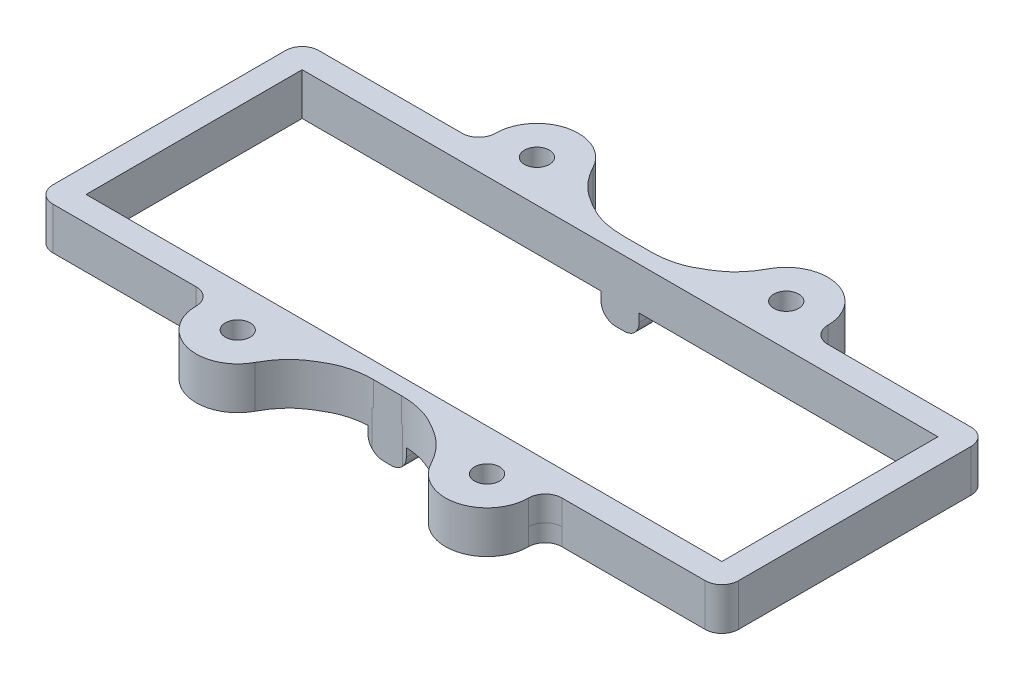
from build123d import *
from build123d.topology import SkipClean

# Parameters (mm, degrees)
SKETCH1_W           = 40
SKETCH1_H           = 7
SKETCH1_R           = 1.5
SKETCH1_W_2         = 82.5
SKETCH1_H_2         = 32
SKETCH1_W_3         = 76.5
SKETCH1_H_3         = 26
BOSS_EXTRUDE1_DEPTH = 2.085
SKETCH2_W           = 5
SKETCH2_H           = 10
BOSS_EXTRUDE2_DEPTH = 3
FILLET1_R           = 2
FILLET2_R           = 2
CUT_EXTRUDE1_DEPTH  = 65.136818612
SKETCH4_W           = 30
SKETCH4_H           = 6.817038716
CUT_EXTRUDE2_DEPTH  = 53.089568977
FILLET3_R           = 5
FILLET4_R           = 2
BOSS_EXTRUDE3_START = 3
SKETCH5_R           = 1.5
BOSS_EXTRUDE3_DEPTH = 3
FILLET5_START       = 2.085
FILLET5_DEPTH       = 3


with BuildPart() as part:
    # Sketch1 → Boss-Extrude1 (new body)
    # profile 1 of 3: a face of its own
    with BuildSketch(Plane(origin=(0, 0, 0), x_dir=(1, 0, 0), z_dir=(0, 1, 0))):
        with Locations((-3.342953498, -16.024946279)):
            Rectangle(SKETCH1_W, SKETCH1_H)
        with Locations(Location((-18.342953498, -14.524946279, 0), (0, 0, 270))):
            Circle(SKETCH1_R, mode=Mode.SUBTRACT)
        with Locations(Location((11.657046502, -14.524946279, 0), (0, 0, 270))):
            Circle(SKETCH1_R, mode=Mode.SUBTRACT)
    # profile 2 of 3: a face of its own
    with BuildSketch(Plane(origin=(0, 0, 0), x_dir=(1, 0, 0), z_dir=(0, 1, 0))):
        with Locations((-3.342953498, 3.475053721)):
            Rectangle(SKETCH1_W_2, SKETCH1_H_2)
        with Locations((-3.342953498, 3.475053721)):
            Rectangle(SKETCH1_W_3, SKETCH1_H_3, mode=Mode.SUBTRACT)
    # profile 3 of 3: a face of its own
    with BuildSketch(Plane(origin=(0, 0, 0), x_dir=(1, 0, 0), z_dir=(0, 1, 0))):
        with Locations((-3.342953498, 22.975053721)):
            Rectangle(SKETCH1_W, SKETCH1_H)
        with Locations(Location((-18.342953498, 21.475053721, 0), (0, 0, 270))):
            Circle(SKETCH1_R, mode=Mode.SUBTRACT)
        with Locations(Location((11.657046502, 21.475053721, 0), (0, 0, 270))):
            Circle(SKETCH1_R, mode=Mode.SUBTRACT)
    extrude(amount=BOSS_EXTRUDE1_DEPTH)

    # Sketch2 → Boss-Extrude2 (add)
    with BuildSketch(Plane.XZ):
        with Locations((-3.342953498, 14.524946279)):
            Rectangle(SKETCH2_W, SKETCH2_H)
        with Locations((-3.342953498, -21.475053721)):
            Rectangle(SKETCH2_W, SKETCH2_H)
    extrude(amount=BOSS_EXTRUDE2_DEPTH)

    # Fillet1
    fillet1_edges = [part.edges().sort_by_distance(p)[0] for p in [
        (-5.842953498, -3, 14.524946279),
        (-0.842953498, -3, 14.524946279),
        (-0.842953498, -3, -21.475053721),
        (-5.842953498, -3, -21.475053721),
    ]]
    fillet(fillet1_edges, radius=FILLET1_R)

    # Fillet2
    fillet2_edges = [part.edges().sort_by_distance(p)[0] for p in [
        (-44.592953498, 1.0425, 12.524946279),
        (-44.592953498, 1.0425, -19.475053721),
        (37.907046502, 1.0425, -19.475053721),
        (37.907046502, 1.0425, 12.524946279),
    ]]
    fillet(fillet2_edges, radius=FILLET2_R)

    # Sketch3 → Cut-Extrude1 (cut, through all)
    with BuildSketch(Plane(origin=(0, 0, -26.475053721), x_dir=(-1, 0, 0), z_dir=(0, 0, -1))):
        with BuildLine():
            Line((5.842953498, -1), (5.842953498, 0))
            Line((5.842953498, 0), (5.642953498, 0))
            Line((5.642953498, 0), (5.642953498, -1))
            ThreePointArc((5.642953498, -1), (5.115745704, -2.272792206), (3.842953498, -2.8))
            Line((3.842953498, -2.8), (2.842953498, -2.8))
            ThreePointArc((2.842953498, -2.8), (1.570161291, -2.272792206), (1.042953498, -1))
            Line((1.042953498, -1), (1.042953498, 0))
            Line((1.042953498, 0), (0.842953498, 0))
            Line((0.842953498, 0), (0.842953498, -1))
            ThreePointArc((0.842953498, -1), (1.428739935, -2.414213562), (2.842953498, -3))
            Line((2.842953498, -3), (3.842953498, -3))
            ThreePointArc((3.842953498, -3), (5.25716706, -2.414213562), (5.842953498, -1))
        make_face()
    extrude(amount=-CUT_EXTRUDE1_DEPTH, mode=Mode.SUBTRACT)

    # Sketch4 → Cut-Extrude2 (cut, through all)
    with BuildSketch(Plane(origin=(0, 2.085, 0), x_dir=(1, 0, 0), z_dir=(0, 1, 0))):
        with BuildLine():
            Line((-5.025587433, 18.475053721), (-3.342953498, 18.475053721))
            Line((-3.342953498, 18.475053721), (-1.660319563, 18.475053721))
            Line((-1.660319563, 18.475053721), (-1.5063675, 18.475053721))
            add(Edge.make_bspline(
                [(7.234880115, 23.808387054), (6.697838422, 22.80689338), (5.54618786, 21.222701251), (3.456402004, 19.887657692), (1.890908212, 19.048171258), (0.265447838, 18.611656881), (-0.841891354, 18.480685845), (-1.5063675, 18.475053721)],
                knots=[0, 0, 0, 0, 0.31493804, 0.524439854, 0.679221784, 0.802825172, 0.985869019, 0.985869019, 0.985869019, 0.985869019], degree=3))
            ThreePointArc((7.234880115, 23.808387054), (9.075057605, 25.756797914), (11.657046502, 26.475053721))
            Line((11.657046502, 26.475053721), (-18.342953498, 26.475053721))
            ThreePointArc((-18.342953498, 26.475053721), (-15.7609646, 25.756797914), (-13.92078711, 23.808387054))
            add(Edge.make_bspline(
                [(-13.92078711, 23.808387054), (-13.383745417, 22.80689338), (-12.232094855, 21.222701251), (-10.142308999, 19.887657692), (-8.576815207, 19.048171258), (-6.951354833, 18.611656881), (-5.844015641, 18.480685845), (-5.179539495, 18.475053721)],
                knots=[0, 0, 0, 0, 0.31493804, 0.524439854, 0.679221784, 0.802825172, 0.985869019, 0.985869019, 0.985869019, 0.985869019], degree=3))
            Line((-5.179539495, 18.475053721), (-5.025587433, 18.475053721))
        make_face()
        with Locations((-3.342953498, 29.883573079)):
            Rectangle(SKETCH4_W, SKETCH4_H)
        with BuildLine():
            ThreePointArc((-13.92078711, -16.858279612), (-15.7609646, -18.806690472), (-18.342953498, -19.524946279))
            Line((-18.342953498, -19.524946279), (11.657046502, -19.524946279))
            ThreePointArc((11.657046502, -19.524946279), (9.075057605, -18.806690472), (7.234880115, -16.858279612))
            add(Edge.make_bspline(
                [(7.234880115, -16.858279612), (6.697838422, -15.856785937), (5.54618786, -14.272593809), (3.456402004, -12.937550249), (1.890908212, -12.098063816), (0.265447838, -11.661549439), (-0.841891354, -11.530578403), (-1.5063675, -11.524946279)],
                knots=[0, 0, 0, 0, 0.31493804, 0.524439854, 0.679221784, 0.802825172, 0.985869019, 0.985869019, 0.985869019, 0.985869019], degree=3))
            Line((-1.5063675, -11.524946279), (-1.660319563, -11.524946279))
            Line((-1.660319563, -11.524946279), (-3.342953498, -11.524946279))
            Line((-3.342953498, -11.524946279), (-5.025587433, -11.524946279))
            Line((-5.025587433, -11.524946279), (-5.179539495, -11.524946279))
            add(Edge.make_bspline(
                [(-13.92078711, -16.858279612), (-13.383745417, -15.856785937), (-12.232094855, -14.272593809), (-10.142308999, -12.937550249), (-8.576815207, -12.098063816), (-6.951354833, -11.661549439), (-5.844015641, -11.530578403), (-5.179539495, -11.524946279)],
                knots=[0, 0, 0, 0, 0.31493804, 0.524439854, 0.679221784, 0.802825172, 0.985869019, 0.985869019, 0.985869019, 0.985869019], degree=3))
        make_face()
        with Locations((-3.342953498, -22.933465637)):
            Rectangle(SKETCH4_W, SKETCH4_H)
    extrude(amount=-CUT_EXTRUDE2_DEPTH, mode=Mode.SUBTRACT)

    # Fillet3
    fillet3_edges = [part.edges().sort_by_distance(p)[0] for p in [
        (16.657046502, 1.0425, -26.475053721),
        (-23.342953498, 1.0425, -26.475053721),
        (-23.342953498, 1.0425, 19.524946279),
        (16.657046502, 1.0425, 19.524946279),
    ]]
    fillet(fillet3_edges, radius=FILLET3_R - 0.0001)  # a hair under: the kernel refuses the full size

    # Fillet4
    fillet4_edges = [part.edges().sort_by_distance(p)[0] for p in [
        (-23.342953498, 1.0425, 12.524946279),
        (-23.342953498, 1.0425, -19.475053721),
        (16.657046502, 1.0425, -19.475053721),
        (16.657046502, 1.0425, 12.524946279),
    ]]
    fillet(fillet4_edges, radius=FILLET4_R)

    # Sketch5 → Boss-Extrude3 (add)
    # profile 1 of 26: a face of its own
    with SkipClean():  # the faces are left unmerged after this step: merging them gives an invalid solid
        with BuildSketch(Plane(origin=(0, 2.085, 0), x_dir=(1, 0, 0), z_dir=(0, 1, 0)).offset(BOSS_EXTRUDE3_START)):
            with BuildLine():
                ThreePointArc((-18.343003498, 26.475053721), (-21.878490939, 25.010584091), (-23.342953497, 21.475093721))
                ThreePointArc((-23.342953497, 21.475093721), (-23.237489148, 20.453525081), (-22.925529193, 19.475053721))
                Line((-22.925529193, 19.475053721), (-14.342953498, 19.475053721))
                Line((-14.342953498, 19.475053721), (-14.342953498, 24.475053721))
                ThreePointArc((-14.342953498, 24.475053721), (-16.106907881, 25.947200856), (-18.343003498, 26.475053721))
            make_face()
            with Locations((-18.342953498, 21.475053721)):
                Circle(SKETCH5_R, mode=Mode.SUBTRACT)
        # profile 2 of 26: a face of its own
        with BuildSketch(Plane(origin=(0, 2.085, 0), x_dir=(1, 0, 0), z_dir=(0, 1, 0)).offset(BOSS_EXTRUDE3_START)):
            with BuildLine():
                Line((-22.925529193, 19.475053721), (-23.342953498, 19.475053721))
                Line((-23.342953498, 19.475053721), (-23.342953498, 16.475053721))
                Line((-23.342953498, 16.475053721), (-18.342953499, 16.475053721))
                ThreePointArc((-18.342953499, 16.475053721), (-21.081566286, 17.291753589), (-22.925529193, 19.475053721))
            make_face()
        # profile 3 of 26: a face of its own
        with BuildSketch(Plane(origin=(0, 2.085, 0), x_dir=(1, 0, 0), z_dir=(0, 1, 0)).offset(BOSS_EXTRUDE3_START)):
            with BuildLine():
                Line((-23.342953498, 16.475053721), (-23.342953498, 19.475053721))
                Line((-23.342953498, 19.475053721), (-25.342953498, 19.475053721))
                Line((-25.342953498, 19.475053721), (-42.592953498, 19.475053721))
                ThreePointArc((-42.592953498, 19.475053721), (-44.00716706, 18.889267283), (-44.592953498, 17.475053721))
                Line((-44.592953498, 17.475053721), (-44.592953498, -10.524946279))
                ThreePointArc((-44.592953498, -10.524946279), (-44.00716706, -11.939159841), (-42.592953498, -12.524946279))
                Line((-42.592953498, -12.524946279), (-25.342953498, -12.524946279))
                Line((-25.342953498, -12.524946279), (-23.342953498, -12.524946279))
                Line((-23.342953498, -12.524946279), (-23.342953498, -9.524946279))
                Line((-23.342953498, -9.524946279), (-41.592953498, -9.524946279))
                Line((-41.592953498, -9.524946279), (-41.592953498, 16.475053721))
                Line((-41.592953498, 16.475053721), (-23.342953498, 16.475053721))
            make_face()
        # profile 4 of 26: a face of its own
        with BuildSketch(Plane(origin=(0, 2.085, 0), x_dir=(1, 0, 0), z_dir=(0, 1, 0)).offset(BOSS_EXTRUDE3_START)):
            with BuildLine():
                Line((-14.342953498, 19.475053721), (-22.925529193, 19.475053721))
                ThreePointArc((-22.925529193, 19.475053721), (-21.081566286, 17.291753589), (-18.342953499, 16.475053721))
                ThreePointArc((-18.342953499, 16.475053721), (-16.106885521, 17.002917766), (-14.342953498, 18.475053721))
                Line((-14.342953498, 18.475053721), (-14.342953498, 19.475053721))
            make_face()
        # profile 5 of 26: a face of its own
        with BuildSketch(Plane(origin=(0, 2.085, 0), x_dir=(1, 0, 0), z_dir=(0, 1, 0)).offset(BOSS_EXTRUDE3_START)):
            with BuildLine():
                ThreePointArc((-13.92078711, 23.808387054), (-14.118698205, 24.150061614), (-14.342953498, 24.475053721))
                Line((-14.342953498, 24.475053721), (-14.342953498, 19.475053721))
                Line((-14.342953498, 19.475053721), (-13.760377803, 19.475053721))
                ThreePointArc((-13.760377803, 19.475053721), (-13.448421933, 20.453505503), (-13.342953498, 21.475053721))
                ThreePointArc((-13.342953498, 21.475053721), (-13.489561285, 22.676962217), (-13.92078711, 23.808387054))
            make_face()
        # profile 6 of 26: a face of its own
        with BuildSketch(Plane(origin=(0, 2.085, 0), x_dir=(1, 0, 0), z_dir=(0, 1, 0)).offset(BOSS_EXTRUDE3_START)):
            with BuildLine():
                Line((-13.760377803, 19.475053721), (-14.342953498, 19.475053721))
                Line((-14.342953498, 19.475053721), (-14.342953498, 18.475053721))
                ThreePointArc((-14.342953498, 18.475053721), (-14.022635061, 18.958141206), (-13.760377803, 19.475053721))
            make_face()
        # profile 7 of 26: a face of its own
        with BuildSketch(Plane(origin=(0, 2.085, 0), x_dir=(1, 0, 0), z_dir=(0, 1, 0)).offset(BOSS_EXTRUDE3_START)):
            with BuildLine():
                ThreePointArc((-14.342953498, 18.475053721), (-16.106885521, 17.002917766), (-18.342953499, 16.475053721))
                Line((-18.342953499, 16.475053721), (11.657046523, 16.475053721))
                ThreePointArc((11.657046523, 16.475053721), (9.420978534, 17.002917762), (7.657046502, 18.475053721))
                Line((7.657046502, 18.475053721), (-1.5063675, 18.475053721))
                add(Edge.make_bspline(
                    [(-1.5063675, 18.475053721), (-1.557665042, 18.474618921), (-1.608983344, 18.47461649), (-1.660319563, 18.475053721)],
                    knots=[0.985869019, 0.985869019, 0.985869019, 0.985869019, 1, 1, 1, 1], degree=3))
                Line((-1.660319563, 18.475053721), (-3.342953498, 18.475053721))
                Line((-3.342953498, 18.475053721), (-5.025587433, 18.475053721))
                add(Edge.make_bspline(
                    [(-5.179539495, 18.475053721), (-5.128241953, 18.474618921), (-5.076923651, 18.47461649), (-5.025587433, 18.475053721)],
                    knots=[0.985869019, 0.985869019, 0.985869019, 0.985869019, 1, 1, 1, 1], degree=3))
                Line((-5.179539495, 18.475053721), (-14.342953498, 18.475053721))
            make_face()
        # profile 8 of 26: a face of its own
        with BuildSketch(Plane(origin=(0, 2.085, 0), x_dir=(1, 0, 0), z_dir=(0, 1, 0)).offset(BOSS_EXTRUDE3_START)):
            with BuildLine():
                add(Edge.make_bspline(
                    [(-13.92078711, 23.808387054), (-13.383745417, 22.80689338), (-12.232094855, 21.222701251), (-10.424029044, 20.067632367), (-9.557996846, 19.581589064), (-9.354549961, 19.475053721)],
                    knots=[0, 0, 0, 0, 0.31493804, 0.524439854, 0.587657191, 0.587657191, 0.587657191, 0.587657191], degree=3))
                ThreePointArc((-13.92078711, 23.808387054), (-13.489561285, 22.676962217), (-13.342953498, 21.475053721))
                ThreePointArc((-13.342953498, 21.475053721), (-13.448421933, 20.453505503), (-13.760377803, 19.475053721))
                Line((-13.760377803, 19.475053721), (-9.354549961, 19.475053721))
            make_face()
        # profile 9 of 26: a face of its own
        with BuildSketch(Plane(origin=(0, 2.085, 0), x_dir=(1, 0, 0), z_dir=(0, 1, 0)).offset(BOSS_EXTRUDE3_START)):
            with BuildLine():
                ThreePointArc((-13.760377803, 19.475053721), (-14.022635061, 18.958141206), (-14.342953498, 18.475053721))
                Line((-14.342953498, 18.475053721), (-5.179539495, 18.475053721))
                add(Edge.make_bspline(
                    [(-9.354549961, 19.475053721), (-9.059875559, 19.320746917), (-8.354121704, 18.98836733), (-6.951354833, 18.611656881), (-5.844015641, 18.480685845), (-5.179539495, 18.475053721)],
                    knots=[0.587657191, 0.587657191, 0.587657191, 0.587657191, 0.679221784, 0.802825172, 0.985869019, 0.985869019, 0.985869019, 0.985869019], degree=3))
                Line((-9.354549961, 19.475053721), (-13.760377803, 19.475053721))
            make_face()
        # profile 10 of 26: a face of its own
        with BuildSketch(Plane(origin=(0, 2.085, 0), x_dir=(1, 0, 0), z_dir=(0, 1, 0)).offset(BOSS_EXTRUDE3_START)):
            with BuildLine():
                ThreePointArc((16.239622197, 19.475053721), (14.395659298, 17.291753594), (11.657046523, 16.475053721))
                Line((11.657046523, 16.475053721), (16.657046502, 16.475053721))
                Line((16.657046502, 16.475053721), (16.657046502, 19.475053721))
                Line((16.657046502, 19.475053721), (16.239622197, 19.475053721))
            make_face()
        # profile 11 of 26: a face of its own
        with BuildSketch(Plane(origin=(0, 2.085, 0), x_dir=(1, 0, 0), z_dir=(0, 1, 0)).offset(BOSS_EXTRUDE3_START)):
            with BuildLine():
                ThreePointArc((7.657046502, 18.475053721), (9.420978534, 17.002917762), (11.657046523, 16.475053721))
                ThreePointArc((11.657046523, 16.475053721), (14.395659298, 17.291753594), (16.239622197, 19.475053721))
                Line((16.239622197, 19.475053721), (7.074470807, 19.475053721))
                ThreePointArc((7.074470807, 19.475053721), (7.336728066, 18.958141206), (7.657046502, 18.475053721))
            make_face()
        # profile 12 of 26: a face of its own
        with BuildSketch(Plane(origin=(0, 2.085, 0), x_dir=(1, 0, 0), z_dir=(0, 1, 0)).offset(BOSS_EXTRUDE3_START)):
            with BuildLine():
                Line((16.657046502, 19.475053721), (16.657046502, 16.475053721))
                Line((16.657046502, 16.475053721), (34.907046502, 16.475053721))
                Line((34.907046502, 16.475053721), (34.907046502, -9.524946279))
                Line((34.907046502, -9.524946279), (16.657046502, -9.524946279))
                Line((16.657046502, -9.524946279), (16.657046502, -12.524946279))
                Line((16.657046502, -12.524946279), (18.657046502, -12.524946279))
                Line((18.657046502, -12.524946279), (35.907046502, -12.524946279))
                ThreePointArc((35.907046502, -12.524946279), (37.321260065, -11.939159841), (37.907046502, -10.524946279))
                Line((37.907046502, -10.524946279), (37.907046502, 17.475053721))
                ThreePointArc((37.907046502, 17.475053721), (37.321260065, 18.889267283), (35.907046502, 19.475053721))
                Line((35.907046502, 19.475053721), (18.657046502, 19.475053721))
                Line((18.657046502, 19.475053721), (16.657046502, 19.475053721))
            make_face()
        # profile 13 of 26: a face of its own
        with BuildSketch(Plane(origin=(0, 2.085, 0), x_dir=(1, 0, 0), z_dir=(0, 1, 0)).offset(BOSS_EXTRUDE3_START)):
            with BuildLine():
                Line((-1.5063675, 18.475053721), (7.657046502, 18.475053721))
                ThreePointArc((7.657046502, 18.475053721), (7.336728066, 18.958141206), (7.074470807, 19.475053721))
                Line((7.074470807, 19.475053721), (2.668642966, 19.475053721))
                add(Edge.make_bspline(
                    [(2.668642966, 19.475053721), (2.373968563, 19.320746917), (1.668214709, 18.98836733), (0.265447838, 18.611656881), (-0.841891354, 18.480685845), (-1.5063675, 18.475053721)],
                    knots=[0.587657191, 0.587657191, 0.587657191, 0.587657191, 0.679221784, 0.802825172, 0.985869019, 0.985869019, 0.985869019, 0.985869019], degree=3))
            make_face()
        # profile 14 of 26: a face of its own
        with BuildSketch(Plane(origin=(0, 2.085, 0), x_dir=(1, 0, 0), z_dir=(0, 1, 0)).offset(BOSS_EXTRUDE3_START)):
            with BuildLine():
                Line((7.074470807, 19.475053721), (16.239622197, 19.475053721))
                ThreePointArc((16.239622197, 19.475053721), (16.551578067, 20.453505503), (16.657046502, 21.475053721))
                ThreePointArc((16.657046502, 21.475053721), (15.192598086, 25.010569949), (11.657096502, 26.475053721))
                ThreePointArc((11.657096502, 26.475053721), (9.075079014, 25.756810824), (7.234880115, 23.808387054))
                ThreePointArc((7.234880115, 23.808387054), (6.66046873, 21.660014702), (7.074470807, 19.475053721))
            make_face()
            with Locations((11.657046502, 21.475053721)):
                Circle(SKETCH5_R, mode=Mode.SUBTRACT)
        # profile 15 of 26: a face of its own
        with BuildSketch(Plane(origin=(0, 2.085, 0), x_dir=(1, 0, 0), z_dir=(0, 1, 0)).offset(BOSS_EXTRUDE3_START)):
            with BuildLine():
                Line((-18.342953493, -9.524946279), (-23.342953498, -9.524946279))
                Line((-23.342953498, -9.524946279), (-23.342953498, -12.524946279))
                Line((-23.342953498, -12.524946279), (-22.925529193, -12.524946279))
                ThreePointArc((-22.925529193, -12.524946279), (-21.081566283, -10.341646145), (-18.342953493, -9.524946279))
            make_face()
        # profile 16 of 26: a face of its own
        with BuildSketch(Plane(origin=(0, 2.085, 0), x_dir=(1, 0, 0), z_dir=(0, 1, 0)).offset(BOSS_EXTRUDE3_START)):
            with BuildLine():
                add(Edge.make_bspline(
                    [(7.234880115, 23.808387054), (6.697838422, 22.80689338), (5.54618786, 21.222701251), (3.738122049, 20.067632367), (2.872089851, 19.581589064), (2.668642966, 19.475053721)],
                    knots=[0, 0, 0, 0, 0.31493804, 0.524439854, 0.587657191, 0.587657191, 0.587657191, 0.587657191], degree=3))
                Line((2.668642966, 19.475053721), (7.074470807, 19.475053721))
                ThreePointArc((7.074470807, 19.475053721), (6.66046873, 21.660014702), (7.234880115, 23.808387054))
            make_face()
        # profile 17 of 26: a face of its own
        with BuildSketch(Plane(origin=(0, 2.085, 0), x_dir=(1, 0, 0), z_dir=(0, 1, 0)).offset(BOSS_EXTRUDE3_START)):
            with BuildLine():
                Line((11.657046502, -9.524946279), (-18.342953493, -9.524946279))
                ThreePointArc((-18.342953493, -9.524946279), (-16.106885518, -10.052810325), (-14.342953498, -11.524946279))
                Line((-14.342953498, -11.524946279), (-5.179539495, -11.524946279))
                add(Edge.make_bspline(
                    [(-5.179539495, -11.524946279), (-5.128241953, -11.524511479), (-5.076923651, -11.524509048), (-5.025587433, -11.524946279)],
                    knots=[0.985869019, 0.985869019, 0.985869019, 0.985869019, 1, 1, 1, 1], degree=3))
                Line((-5.025587433, -11.524946279), (-3.342953498, -11.524946279))
                Line((-3.342953498, -11.524946279), (-1.660319563, -11.524946279))
                add(Edge.make_bspline(
                    [(-1.5063675, -11.524946279), (-1.557665042, -11.524511479), (-1.608983344, -11.524509048), (-1.660319563, -11.524946279)],
                    knots=[0.985869019, 0.985869019, 0.985869019, 0.985869019, 1, 1, 1, 1], degree=3))
                Line((-1.5063675, -11.524946279), (7.657046502, -11.524946279))
                ThreePointArc((7.657046502, -11.524946279), (9.420978525, -10.052810324), (11.657046502, -9.524946279))
            make_face()
        # profile 18 of 26: a face of its own
        with BuildSketch(Plane(origin=(0, 2.085, 0), x_dir=(1, 0, 0), z_dir=(0, 1, 0)).offset(BOSS_EXTRUDE3_START)):
            with BuildLine():
                ThreePointArc((-14.342953498, -11.524946279), (-16.106885518, -10.052810325), (-18.342953493, -9.524946279))
                ThreePointArc((-18.342953493, -9.524946279), (-21.081566283, -10.341646145), (-22.925529193, -12.524946279))
                Line((-22.925529193, -12.524946279), (-13.760377803, -12.524946279))
                ThreePointArc((-13.760377803, -12.524946279), (-14.022635061, -12.008033764), (-14.342953498, -11.524946279))
            make_face()
        # profile 19 of 26: a face of its own
        with BuildSketch(Plane(origin=(0, 2.085, 0), x_dir=(1, 0, 0), z_dir=(0, 1, 0)).offset(BOSS_EXTRUDE3_START)):
            with BuildLine():
                Line((16.657046502, -9.524946279), (11.657046502, -9.524946279))
                ThreePointArc((11.657046502, -9.524946279), (14.39565929, -10.341646146), (16.239622197, -12.524946279))
                Line((16.239622197, -12.524946279), (16.657046502, -12.524946279))
                Line((16.657046502, -12.524946279), (16.657046502, -9.524946279))
            make_face()
        # profile 20 of 26: a face of its own
        with BuildSketch(Plane(origin=(0, 2.085, 0), x_dir=(1, 0, 0), z_dir=(0, 1, 0)).offset(BOSS_EXTRUDE3_START)):
            with BuildLine():
                ThreePointArc((16.239622197, -12.524946279), (14.39565929, -10.341646146), (11.657046502, -9.524946279))
                ThreePointArc((11.657046502, -9.524946279), (9.420978525, -10.052810324), (7.657046502, -11.524946279))
                ThreePointArc((7.657046502, -11.524946279), (7.336728066, -12.008033764), (7.074470807, -12.524946279))
                Line((7.074470807, -12.524946279), (16.239622197, -12.524946279))
            make_face()
        # profile 21 of 26: a face of its own
        with BuildSketch(Plane(origin=(0, 2.085, 0), x_dir=(1, 0, 0), z_dir=(0, 1, 0)).offset(BOSS_EXTRUDE3_START)):
            with BuildLine():
                Line((-5.179539495, -11.524946279), (-14.342953498, -11.524946279))
                ThreePointArc((-14.342953498, -11.524946279), (-14.022635061, -12.008033764), (-13.760377803, -12.524946279))
                Line((-13.760377803, -12.524946279), (-9.354549961, -12.524946279))
                add(Edge.make_bspline(
                    [(-9.354549961, -12.524946279), (-9.059875559, -12.370639475), (-8.354121704, -12.038259888), (-6.951354833, -11.661549439), (-5.844015641, -11.530578403), (-5.179539495, -11.524946279)],
                    knots=[0.587657191, 0.587657191, 0.587657191, 0.587657191, 0.679221784, 0.802825172, 0.985869019, 0.985869019, 0.985869019, 0.985869019], degree=3))
            make_face()
        # profile 22 of 26: a face of its own
        with BuildSketch(Plane(origin=(0, 2.085, 0), x_dir=(1, 0, 0), z_dir=(0, 1, 0)).offset(BOSS_EXTRUDE3_START)):
            with BuildLine():
                Line((-13.760377803, -12.524946279), (-22.925529193, -12.524946279))
                ThreePointArc((-22.925529193, -12.524946279), (-23.237489148, -13.503417639), (-23.342953497, -14.524986279))
                ThreePointArc((-23.342953497, -14.524986279), (-21.878490939, -18.060476649), (-18.343003498, -19.524946279))
                ThreePointArc((-18.343003498, -19.524946279), (-15.760986009, -18.806703382), (-13.92078711, -16.858279612))
                ThreePointArc((-13.92078711, -16.858279612), (-13.489561285, -15.726854775), (-13.342953498, -14.524946279))
                ThreePointArc((-13.342953498, -14.524946279), (-13.448421933, -13.50339806), (-13.760377803, -12.524946279))
            make_face()
            with Locations((-18.342953498, -14.524946279)):
                Circle(SKETCH5_R, mode=Mode.SUBTRACT)
        # profile 23 of 26: a face of its own
        with BuildSketch(Plane(origin=(0, 2.085, 0), x_dir=(1, 0, 0), z_dir=(0, 1, 0)).offset(BOSS_EXTRUDE3_START)):
            with BuildLine():
                ThreePointArc((16.657046502, -14.524946279), (16.551578067, -13.50339806), (16.239622197, -12.524946279))
                Line((16.239622197, -12.524946279), (7.074470807, -12.524946279))
                ThreePointArc((7.074470807, -12.524946279), (6.66046873, -14.709907259), (7.234880115, -16.858279612))
                ThreePointArc((7.234880115, -16.858279612), (9.075079014, -18.806703382), (11.657096502, -19.524946279))
                ThreePointArc((11.657096502, -19.524946279), (15.192598086, -18.060462507), (16.657046502, -14.524946279))
            make_face()
            with Locations((11.657046502, -14.524946279)):
                Circle(SKETCH5_R, mode=Mode.SUBTRACT)
        # profile 24 of 26: a face of its own
        with BuildSketch(Plane(origin=(0, 2.085, 0), x_dir=(1, 0, 0), z_dir=(0, 1, 0)).offset(BOSS_EXTRUDE3_START)):
            with BuildLine():
                ThreePointArc((7.074470807, -12.524946279), (7.336728066, -12.008033764), (7.657046502, -11.524946279))
                Line((7.657046502, -11.524946279), (-1.5063675, -11.524946279))
                add(Edge.make_bspline(
                    [(2.668642966, -12.524946279), (2.373968563, -12.370639475), (1.668214709, -12.038259888), (0.265447838, -11.661549439), (-0.841891354, -11.530578403), (-1.5063675, -11.524946279)],
                    knots=[0.587657191, 0.587657191, 0.587657191, 0.587657191, 0.679221784, 0.802825172, 0.985869019, 0.985869019, 0.985869019, 0.985869019], degree=3))
                Line((2.668642966, -12.524946279), (7.074470807, -12.524946279))
            make_face()
        # profile 25 of 26: a face of its own
        with BuildSketch(Plane(origin=(0, 2.085, 0), x_dir=(1, 0, 0), z_dir=(0, 1, 0)).offset(BOSS_EXTRUDE3_START)):
            with BuildLine():
                Line((-9.354549961, -12.524946279), (-13.760377803, -12.524946279))
                ThreePointArc((-13.760377803, -12.524946279), (-13.448421933, -13.50339806), (-13.342953498, -14.524946279))
                ThreePointArc((-13.342953498, -14.524946279), (-13.489561285, -15.726854775), (-13.92078711, -16.858279612))
                add(Edge.make_bspline(
                    [(-13.92078711, -16.858279612), (-13.383745417, -15.856785937), (-12.232094855, -14.272593809), (-10.424029044, -13.117524925), (-9.557996846, -12.631481622), (-9.354549961, -12.524946279)],
                    knots=[0, 0, 0, 0, 0.31493804, 0.524439854, 0.587657191, 0.587657191, 0.587657191, 0.587657191], degree=3))
            make_face()
        # profile 26 of 26: a face of its own
        with BuildSketch(Plane(origin=(0, 2.085, 0), x_dir=(1, 0, 0), z_dir=(0, 1, 0)).offset(BOSS_EXTRUDE3_START)):
            with BuildLine():
                ThreePointArc((7.234880115, -16.858279612), (6.66046873, -14.709907259), (7.074470807, -12.524946279))
                Line((7.074470807, -12.524946279), (2.668642966, -12.524946279))
                add(Edge.make_bspline(
                    [(7.234880115, -16.858279612), (6.697838422, -15.856785937), (5.54618786, -14.272593809), (3.738122049, -13.117524925), (2.872089851, -12.631481622), (2.668642966, -12.524946279)],
                    knots=[0, 0, 0, 0, 0.31493804, 0.524439854, 0.587657191, 0.587657191, 0.587657191, 0.587657191], degree=3))
            make_face()
        extrude(amount=-BOSS_EXTRUDE3_DEPTH)
    add(part.part.scale(1), mode=Mode.REPLACE)  # the faces are merged on a copy

    # Fillet5: read off the stored shape, not the designer's step
    # Fillet5 outline → Fillet5 (add)
    with SkipClean():  # the faces are left unmerged after this step: merging them gives an invalid solid
        with BuildSketch(Plane(origin=(0, 0, 0), x_dir=(1, 0, 0), z_dir=(0, 1, 0)).offset(FILLET5_START)):
            with BuildLine():
                ThreePointArc((16.657046502, -14.524946279), (17.24283294, -13.110732717), (18.657046502, -12.524946279))
                Line((18.657046502, -12.524946279), (16.239622197, -12.524946279))
                ThreePointArc((16.239622197, -12.524946279), (16.551578067, -13.503398061), (16.657046502, -14.524946279))
            make_face()
            with BuildLine():
                ThreePointArc((-25.342953498, -12.524946279), (-23.928739935, -13.110732716), (-23.342953498, -14.524946279))
                ThreePointArc((-23.342953498, -14.524946279), (-23.237485063, -13.503398061), (-22.925529193, -12.524946279))
                Line((-22.925529193, -12.524946279), (-25.342953498, -12.524946279))
            make_face()
            with BuildLine():
                ThreePointArc((-23.342953498, 21.475053721), (-23.928739936, 20.060840158), (-25.342953498, 19.475053721))
                Line((-25.342953498, 19.475053721), (-22.925529193, 19.475053721))
                ThreePointArc((-22.925529193, 19.475053721), (-23.237485063, 20.453505503), (-23.342953498, 21.475053721))
            make_face()
            with BuildLine():
                ThreePointArc((18.657046502, 19.475053721), (17.24283294, 20.060840159), (16.657046502, 21.475053721))
                ThreePointArc((16.657046502, 21.475053721), (16.551578067, 20.453505503), (16.239622197, 19.475053721))
                Line((16.239622197, 19.475053721), (18.657046502, 19.475053721))
            make_face()
        extrude(amount=FILLET5_DEPTH)


solid = part.part
